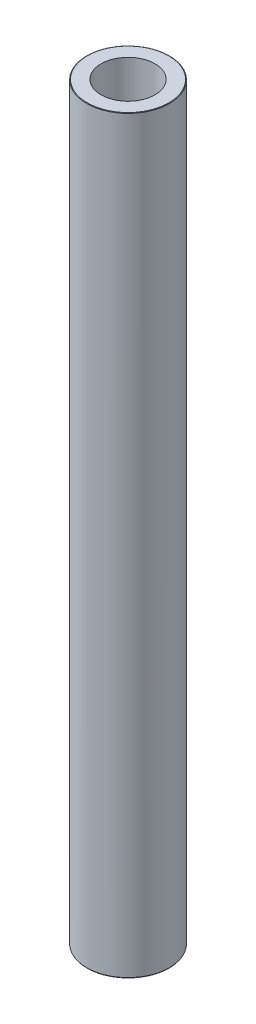
from build123d import *
from OCP.BRepFilletAPI import BRepFilletAPI_MakeChamfer

# Parameters (mm, degrees)
SKETCH1_R           = 25
BOSS_EXTRUDE1_DEPTH = 453.240774435
SKETCH2_R           = 16.29338888
CUT_EXTRUDE1_DEPTH  = 455.617641112
CHAMFER1_SIZE       = 0.211338796
CHAMFER1_SIZE2      = 0.366049532


with BuildPart() as part:
    # Sketch1 → Boss-Extrude1 (new body)
    with BuildSketch(Plane(origin=(0, 0, 0), x_dir=(1, 0, 0), z_dir=(0, 1, 0))):
        Circle(SKETCH1_R)
    extrude(amount=BOSS_EXTRUDE1_DEPTH)

    # Sketch2 → Cut-Extrude1 (cut, through all)
    with BuildSketch(Plane(origin=(0, 0, 0), x_dir=(1, 0, 0), z_dir=(0, 1, 0))):
        Circle(SKETCH2_R)
    extrude(amount=CUT_EXTRUDE1_DEPTH, mode=Mode.SUBTRACT)

    # Chamfer1: one chamfer whose edges measure the first distance from different faces: ONE call of the kernel's chamfer builder (chamfer() names one face for all edges)
    chamfer1_edges_1 = [part.edges().sort_by_distance(p)[0] for p in [
        (-25, 453.240774435, 0),
    ]]
    chamfer1_side_1 = [part.faces().sort_by_distance(p)[0] for p in [
        (-25, 226.620387217, 0),
    ]]
    chamfer1_edges_2 = [part.edges().sort_by_distance(p)[0] for p in [
        (-25, 0, 0),
    ]]
    chamfer1_side_2 = [part.faces().sort_by_distance(p)[0] for p in [
        (-24.292893219, 0, 0),
    ]]
    chamfer1 = BRepFilletAPI_MakeChamfer(part.part.solid().wrapped)
    for e in chamfer1_edges_1:
        chamfer1.Add(CHAMFER1_SIZE, CHAMFER1_SIZE2, e.wrapped, chamfer1_side_1[0].wrapped)  # the first distance lies on this face
    for e in chamfer1_edges_2:
        chamfer1.Add(CHAMFER1_SIZE, CHAMFER1_SIZE2, e.wrapped, chamfer1_side_2[0].wrapped)  # the first distance lies on this face
    add(Compound.cast(chamfer1.Shape()), mode=Mode.REPLACE)


solid = part.part
